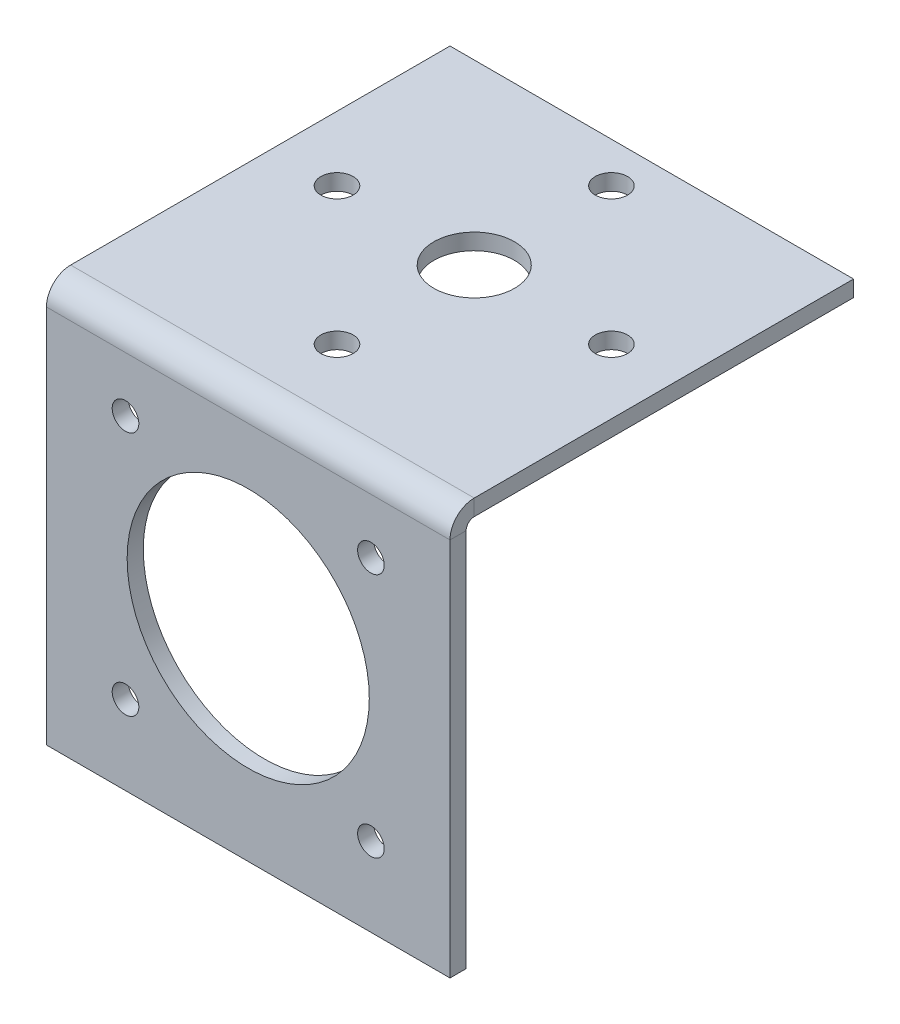
from build123d import *

# Parameters (mm, degrees)
SKETCH_1_W                       = 50
SKETCH_1_H                       = 50
SM_BASE_FLANGE_1_DEPTH           = 2
SM_EDGE_FLANGE_1_STRIP_W         = 10
SM_EDGE_FLANGE_1_STRIP_H         = 2
SM_EDGE_FLANGE_1_STRIP_CUT_DEPTH = 50
SM_EDGE_FLANGE_1_DEPTH           = 50
SKETCH_9_R                       = 15
SKETCH_9_R_2                     = 1.65
CUT_EXTRUDE_2_DEPTH              = 10
SKETCH_12_R                      = 5
SKETCH_12_R_2                    = 2
CUT_EXTRUDE_4_DEPTH              = 10


# Sheet-metal steps are written as plain solids
with BuildPart() as part:
    # Sketch 1 → 基体-法兰1 (new body)
    with BuildSketch(Plane.XY):
        Rectangle(SKETCH_1_W, SKETCH_1_H)
    extrude(amount=-SM_BASE_FLANGE_1_DEPTH)

    # 边线-法兰1 strip (across the edge) → 边线-法兰1 strip cut (cut)
    with BuildSketch(Plane(origin=(-25, 25, -2), x_dir=(0, -1, 0), z_dir=(1, 0, 0))):
        with Locations((-2, -1)):
            Rectangle(SM_EDGE_FLANGE_1_STRIP_W, SM_EDGE_FLANGE_1_STRIP_H)
    extrude(amount=SM_EDGE_FLANGE_1_STRIP_CUT_DEPTH, mode=Mode.SUBTRACT)

    # 边线-法兰1 section (across the edge) → 边线-法兰1 (add)
    with BuildSketch(Plane(origin=(-25, 25, -2), x_dir=(0, -1, 0), z_dir=(1, 0, 0))):
        with BuildLine():
            Line((0, 1), (0, 48))
            Line((0, 48), (2, 48))
            Line((2, 48), (2, 1))
            ThreePointArc((2, 1), (2.292893219, 0.292893219), (3, 0))
            Line((3, 0), (3, -2))
            ThreePointArc((3, -2), (0.878679656, -1.121320344), (0, 1))
        make_face()
    extrude(amount=SM_EDGE_FLANGE_1_DEPTH)

    # 草图9 → 切除-拉伸2 (cut)
    with BuildSketch(Plane.XY):
        Circle(SKETCH_9_R)
        with Locations((-15.202795796, 15.202795796)):
            Circle(SKETCH_9_R_2)
        with Locations((15.202795796, 15.202795796)):
            Circle(SKETCH_9_R_2)
        with Locations((15.202795796, -15.202795796)):
            Circle(SKETCH_9_R_2)
        with Locations((-15.202795796, -15.202795796)):
            Circle(SKETCH_9_R_2)
    extrude(amount=-CUT_EXTRUDE_2_DEPTH, mode=Mode.SUBTRACT)

    # 草图12 → 切除-拉伸4 (cut)
    with BuildSketch(Plane(origin=(0, 25, 0), x_dir=(1, 0, 0), z_dir=(0, 1, 0))):
        with Locations(Location((0, 28, 0), (0, 0, 270))):
            Circle(SKETCH_12_R)
        with Locations(Location((0, 45, 0), (0, 0, 270))):
            Circle(SKETCH_12_R_2)
        with Locations(Location((17, 28, 0), (0, 0, 270))):
            Circle(SKETCH_12_R_2)
        with Locations(Location((0, 11, 0), (0, 0, 270))):
            Circle(SKETCH_12_R_2)
        with Locations(Location((-17, 28, 0), (0, 0, 270))):
            Circle(SKETCH_12_R_2)
    extrude(amount=-CUT_EXTRUDE_4_DEPTH, mode=Mode.SUBTRACT)


solid = part.part
